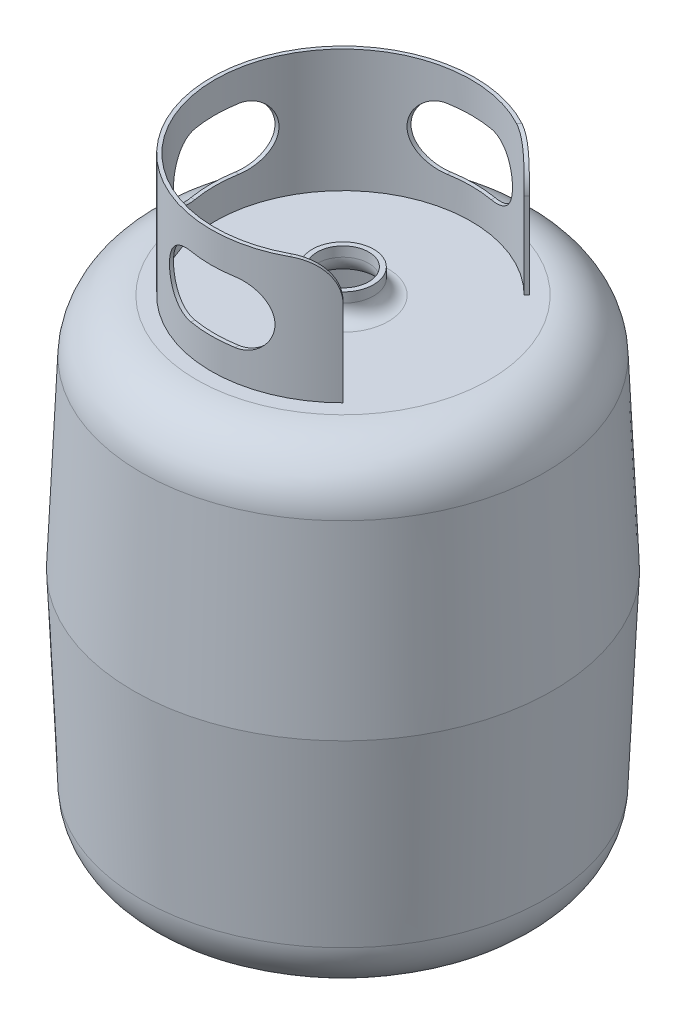
from build123d import *

# Parameters (mm, degrees)
SKETCH2_R           = 21
CUT_EXTRUDE1_DEPTH  = 40
BOSS_EXTRUDE1_DEPTH = 100
FILLET1_R           = 30
CUT_EXTRUDE2_DEPTH  = 474.825305119
CIRPATTERN1_COUNT   = 2
CIRPATTERN1_ANGLE   = 90


with BuildPart() as part:
    # Sketch1 → Revolve1 (revolve)
    with BuildSketch(Plane.XY, mode=Mode.PRIVATE) as revolve1_sk:
        with BuildLine():
            Line((0, 0), (-25, 0))
            Line((-25, 0), (-25, -8))
            ThreePointArc((-25, -8), (-28.514718626, -16.485281374), (-37, -20))
            Line((-37, -20), (-119.421871599, -20))
            ThreePointArc((-119.421871599, -20), (-150.539959109, -32.493621707), (-164.37904157, -63.037127569))
            Line((-164.37904157, -63.037127569), (-170.959307689, -213.75))
            Line((-170.959307689, -213.75), (-164.37904157, -364.462872431))
            ThreePointArc((-164.37904157, -364.462872431), (-150.539959109, -395.006378293), (-119.421871599, -407.5))
            Line((-119.421871599, -407.5), (0, -407.5))
            Line((0, -407.5), (0, -403.5))
            Line((0, -403.5), (-119.421871599, -403.5))
            ThreePointArc((-119.421871599, -403.5), (-147.773906886, -392.116922444), (-160.382848683, -364.288394882))
            Line((-160.382848683, -364.288394882), (-166.955496948, -213.75))
            Line((-166.955496948, -213.75), (-160.382848683, -63.211605118))
            ThreePointArc((-160.382848683, -63.211605118), (-147.773906886, -35.383077556), (-119.421871599, -24))
            Line((-119.421871599, -24), (-37, -24))
            ThreePointArc((-37, -24), (-25.686291501, -19.313708499), (-21, -8))
            Line((-21, -8), (-21, -4))
            Line((-21, -4), (0, -4))
            Line((0, -4), (0, 0))
        make_face()
    revolve(revolve1_sk.sketch.rotate(Axis((0, 0, 0), (0, -1, 0)), 270), axis=Axis((0, 0, 0), (0, -1, 0)))

    # Sketch2 → Cut-Extrude1 (cut)
    with BuildSketch(Plane(origin=(0, 0, 0), x_dir=(1, 0, 0), z_dir=(0, 1, 0))):
        with Locations(Location((0, 0, 0), (0, 0, 270))):
            Circle(SKETCH2_R)
    extrude(amount=-CUT_EXTRUDE1_DEPTH, mode=Mode.SUBTRACT)

    # Sketch3 → Boss-Extrude1 (add)
    with BuildSketch(Plane(origin=(0, -20, 0), x_dir=(1, 0, 0), z_dir=(0, 1, 0))):
        with BuildLine():
            ThreePointArc((73.837413512, -73.837413512), (-104.421871599, 0), (73.837413512, 73.837413512))
            Line((73.837413512, 73.837413512), (75.958733855, 75.958733855))
            ThreePointArc((75.958733855, 75.958733855), (-107.421871599, 0), (75.958733855, -75.958733855))
            Line((75.958733855, -75.958733855), (73.837413512, -73.837413512))
        make_face()
    extrude(amount=BOSS_EXTRUDE1_DEPTH)

    # Fillet1
    # the kernel refuses this fillet: 30 mm, written as the material it takes off along each edge
    with BuildSketch(Plane(origin=(128.991742444, 80, 128.991742444), x_dir=(0, -1, 0), z_dir=(-0.707106781186557, 0, -0.707106781186538)), Plane(origin=(20.804404923, 80, -20.804404923), x_dir=(0, -1, 0), z_dir=(0.7071067811865476, 0, -0.7071067811865476))) as fillet1_piece_1:
        with BuildLine():
            CenterArc((FILLET1_R, FILLET1_R), FILLET1_R, 180, 90)
            Line((0, FILLET1_R), (0, 0))
            Line((0, 0), (FILLET1_R, 0))
        make_face()
    extrude(amount=153, mode=Mode.SUBTRACT)

    # Sketch4 → Cut-Extrude2 (cut, symmetric)
    with BuildSketch(Plane.XY):
        with BuildLine():
            Line((-18, 55), (18, 55))
            ThreePointArc((18, 55), (43, 30), (18, 5))
            Line((18, 5), (-18, 5))
            ThreePointArc((-18, 5), (-43, 30), (-18, 55))
        make_face()
    cut_extrude2 = extrude(amount=CUT_EXTRUDE2_DEPTH, both=True, mode=Mode.SUBTRACT)

    # CirPattern1: Cut-Extrude2 ×2 about axis
    cirpattern1_axis = Axis((0, 80, 0), (0, 1, 0))
    for i in range(1, CIRPATTERN1_COUNT):
        add(cut_extrude2.rotate(cirpattern1_axis, i * CIRPATTERN1_ANGLE / (CIRPATTERN1_COUNT - 1)), mode=Mode.SUBTRACT)


solid = part.part
